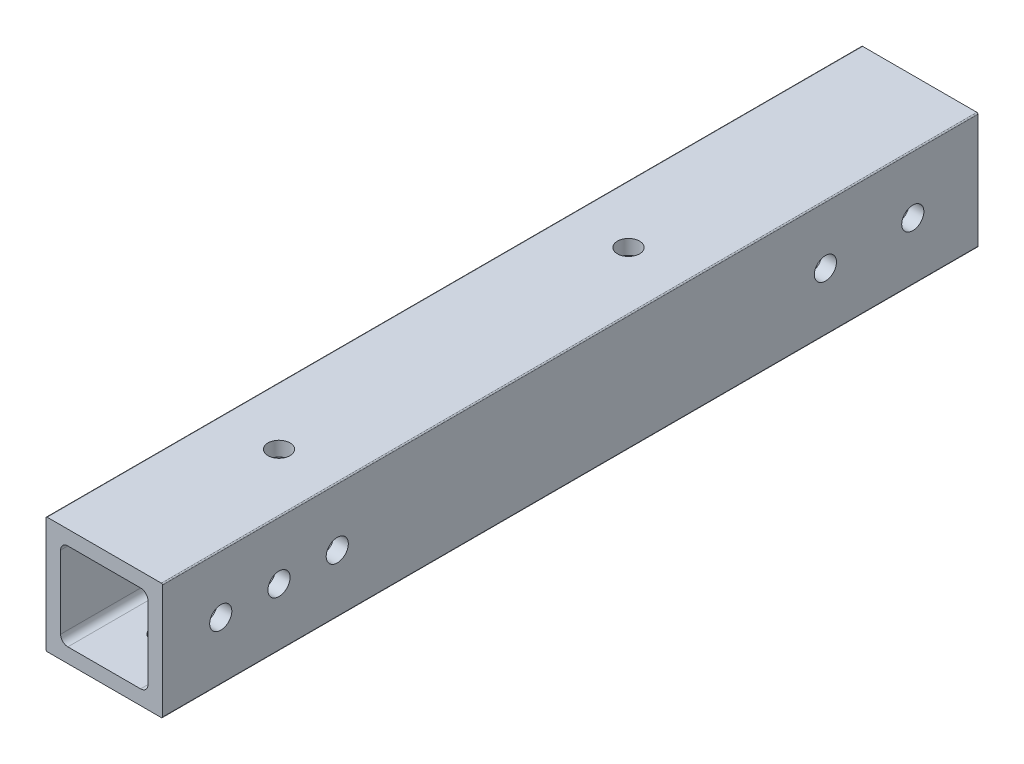
from build123d import *

# Parameters (mm, degrees)
CUT_EXTRUDE1_START = 1651
CUT_EXTRUDE1_DEPTH = 177.8
CUT_EXTRUDE2_REACH = 1831.153
SKETCH2_R          = 2.413
CUT_EXTRUDE3_REACH = 1831.153
SKETCH5_R          = 2.413
SKETCH6_R          = 2.413
CUT_EXTRUDE6_DEPTH = 12.7
SKETCH7_R          = 2.413
CUT_EXTRUDE7_DEPTH = 12.7
CUT_EXTRUDE8_REACH = 1831.153
SKETCH8_R          = 2.413
CUT_EXTRUDE9_REACH = 1831.153
SKETCH9_R          = 2.413


with BuildPart() as part:
    # Cut-Extrude1: read off the stored shape, not the designer's step
    # Cut-Extrude1 outline → Cut-Extrude1 (new body)
    with BuildSketch(Plane.XY.offset(CUT_EXTRUDE1_START)):
        with BuildLine():
            Line((0, 25.146), (0, 0.254))
            ThreePointArc((0, 0.254), (0.074394878, 0.074394878), (0.254, 0))
            Line((0.254, 0), (25.146, 0))
            ThreePointArc((25.146, 0), (25.325605122, 0.074394878), (25.4, 0.254))
            Line((25.4, 0.254), (25.4, 25.146))
            ThreePointArc((25.4, 25.146), (25.325605122, 25.325605122), (25.146, 25.4))
            Line((25.146, 25.4), (0.254, 25.4))
            ThreePointArc((0.254, 25.4), (0.074394878, 25.325605122), (0, 25.146))
        make_face()
        with BuildLine():
            ThreePointArc((4.7625, 3.175), (3.639967985, 3.639967985), (3.175, 4.7625))
            Line((3.175, 4.7625), (3.175, 20.6375))
            ThreePointArc((3.175, 20.6375), (3.639967985, 21.760032015), (4.7625, 22.225))
            Line((4.7625, 22.225), (20.6375, 22.225))
            ThreePointArc((20.6375, 22.225), (21.760032015, 21.760032015), (22.225, 20.6375))
            Line((22.225, 20.6375), (22.225, 4.7625))
            ThreePointArc((22.225, 4.7625), (21.760032015, 3.639967985), (20.6375, 3.175))
            Line((20.6375, 3.175), (4.7625, 3.175))
        make_face(mode=Mode.SUBTRACT)
    extrude(amount=CUT_EXTRUDE1_DEPTH)

    # Sketch2 → Cut-Extrude2 (cut, up to next)
    with BuildSketch(Plane(origin=(25.4, 0, 0), x_dir=(0, 0, -1), z_dir=(1, 0, 0)), mode=Mode.PRIVATE) as cut_extrude2_sk1:
        with Locations((-1665.216211664, 12.7)):
            Circle(SKETCH2_R)
    cut_extrude2_tool1 = extrude(cut_extrude2_sk1.sketch, amount=-CUT_EXTRUDE2_REACH, mode=Mode.PRIVATE) & part.part
    # Sketch2 → Cut-Extrude2 (cut, up to next)
    with BuildSketch(Plane(origin=(25.4, 0, 0), x_dir=(0, 0, -1), z_dir=(1, 0, 0)), mode=Mode.PRIVATE) as cut_extrude2_sk2:
        with Locations((-1684.266211664, 12.7)):
            Circle(SKETCH2_R)
    cut_extrude2_tool2 = extrude(cut_extrude2_sk2.sketch, amount=-CUT_EXTRUDE2_REACH, mode=Mode.PRIVATE) & part.part
    add(cut_extrude2_tool1.solids().sort_by_distance((25.4, 12.7, 1665.216212))[0], mode=Mode.SUBTRACT)
    add(cut_extrude2_tool2.solids().sort_by_distance((25.4, 12.7, 1684.266212))[0], mode=Mode.SUBTRACT)

    # Sketch5 → Cut-Extrude3 (cut, up to next)
    with BuildSketch(Plane.XZ, mode=Mode.PRIVATE) as cut_extrude3_sk1:
        with Locations(Location((12.7, 1684.02, 0), (0, 0, 90))):
            Circle(SKETCH5_R)
    cut_extrude3_tool1 = extrude(cut_extrude3_sk1.sketch, amount=-CUT_EXTRUDE3_REACH, mode=Mode.PRIVATE) & part.part
    # Sketch5 → Cut-Extrude3 (cut, up to next)
    with BuildSketch(Plane.XZ, mode=Mode.PRIVATE) as cut_extrude3_sk2:
        with Locations(Location((12.7, 1664.97, 0), (0, 0, 90))):
            Circle(SKETCH5_R)
    cut_extrude3_tool2 = extrude(cut_extrude3_sk2.sketch, amount=-CUT_EXTRUDE3_REACH, mode=Mode.PRIVATE) & part.part
    add(cut_extrude3_tool1.solids().sort_by_distance((12.7, 0, 1684.02))[0], mode=Mode.SUBTRACT)
    add(cut_extrude3_tool2.solids().sort_by_distance((12.7, 0, 1664.97))[0], mode=Mode.SUBTRACT)

    # Sketch6 → Cut-Extrude6 (cut)
    with BuildSketch(Plane(origin=(0, 25.4, 0), x_dir=(1, 0, 0), z_dir=(0, 1, 0))):
        with Locations((12.7, -1638.3)):
            Circle(SKETCH6_R)
        with Locations(Location((12.7, -1714.5, 0), (0, 0, 270))):
            Circle(SKETCH6_R)
        with Locations(Location((12.7, -1790.7, 0), (0, 0, 270))):
            Circle(SKETCH6_R)
    extrude(amount=-CUT_EXTRUDE6_DEPTH, mode=Mode.SUBTRACT)

    # Sketch7 → Cut-Extrude7 (cut)
    with BuildSketch(Plane.ZY):
        with Locations((1638.3, 12.7)):
            Circle(SKETCH7_R)
        with Locations((1714.5, 12.7)):
            Circle(SKETCH7_R)
        with Locations((1790.7, 12.7)):
            Circle(SKETCH7_R)
    extrude(amount=-CUT_EXTRUDE7_DEPTH, mode=Mode.SUBTRACT)

    # Sketch8 → Cut-Extrude8 (cut, up to next)
    with BuildSketch(Plane(origin=(25.4, 0, 0), x_dir=(0, 0, -1), z_dir=(1, 0, 0)), mode=Mode.PRIVATE) as cut_extrude8_sk1:
        with Locations(Location((-1790.7, 12.7, 0), (0, 0, 180))):
            Circle(SKETCH8_R)
    cut_extrude8_tool1 = extrude(cut_extrude8_sk1.sketch, amount=-CUT_EXTRUDE8_REACH, mode=Mode.PRIVATE) & part.part
    # Sketch8 → Cut-Extrude8 (cut, up to next)
    with BuildSketch(Plane(origin=(25.4, 0, 0), x_dir=(0, 0, -1), z_dir=(1, 0, 0)), mode=Mode.PRIVATE) as cut_extrude8_sk2:
        with Locations((-1803.4, 12.7)):
            Circle(SKETCH8_R)
    cut_extrude8_tool2 = extrude(cut_extrude8_sk2.sketch, amount=-CUT_EXTRUDE8_REACH, mode=Mode.PRIVATE) & part.part
    # Sketch8 → Cut-Extrude8 (cut, up to next)
    with BuildSketch(Plane(origin=(25.4, 0, 0), x_dir=(0, 0, -1), z_dir=(1, 0, 0)), mode=Mode.PRIVATE) as cut_extrude8_sk3:
        with Locations((-1816.1, 12.7)):
            Circle(SKETCH8_R)
    cut_extrude8_tool3 = extrude(cut_extrude8_sk3.sketch, amount=-CUT_EXTRUDE8_REACH, mode=Mode.PRIVATE) & part.part
    add(cut_extrude8_tool1.solids().sort_by_distance((25.4, 12.7, 1790.7))[0], mode=Mode.SUBTRACT)
    add(cut_extrude8_tool2.solids().sort_by_distance((25.4, 12.7, 1803.4))[0], mode=Mode.SUBTRACT)
    add(cut_extrude8_tool3.solids().sort_by_distance((25.4, 12.7, 1816.1))[0], mode=Mode.SUBTRACT)

    # Sketch9 → Cut-Extrude9 (cut, up to next)
    with BuildSketch(Plane.XZ, mode=Mode.PRIVATE) as cut_extrude9_sk1:
        with Locations(Location((12.7, 1816.1, 0), (0, 0, 270))):
            Circle(SKETCH9_R)
    cut_extrude9_tool1 = extrude(cut_extrude9_sk1.sketch, amount=-CUT_EXTRUDE9_REACH, mode=Mode.PRIVATE) & part.part
    # Sketch9 → Cut-Extrude9 (cut, up to next)
    with BuildSketch(Plane.XZ, mode=Mode.PRIVATE) as cut_extrude9_sk2:
        with Locations(Location((12.7, 1803.4, 0), (0, 0, 270))):
            Circle(SKETCH9_R)
    cut_extrude9_tool2 = extrude(cut_extrude9_sk2.sketch, amount=-CUT_EXTRUDE9_REACH, mode=Mode.PRIVATE) & part.part
    # Sketch9 → Cut-Extrude9 (cut, up to next)
    with BuildSketch(Plane.XZ, mode=Mode.PRIVATE) as cut_extrude9_sk3:
        with Locations(Location((12.7, 1790.7, 0), (0, 0, 90))):
            Circle(SKETCH9_R)
    cut_extrude9_tool3 = extrude(cut_extrude9_sk3.sketch, amount=-CUT_EXTRUDE9_REACH, mode=Mode.PRIVATE) & part.part
    add(cut_extrude9_tool1.solids().sort_by_distance((12.7, 0, 1816.1))[0], mode=Mode.SUBTRACT)
    add(cut_extrude9_tool2.solids().sort_by_distance((12.7, 0, 1803.4))[0], mode=Mode.SUBTRACT)
    add(cut_extrude9_tool3.solids().sort_by_distance((12.7, 0, 1790.7))[0], mode=Mode.SUBTRACT)


solid = part.part
